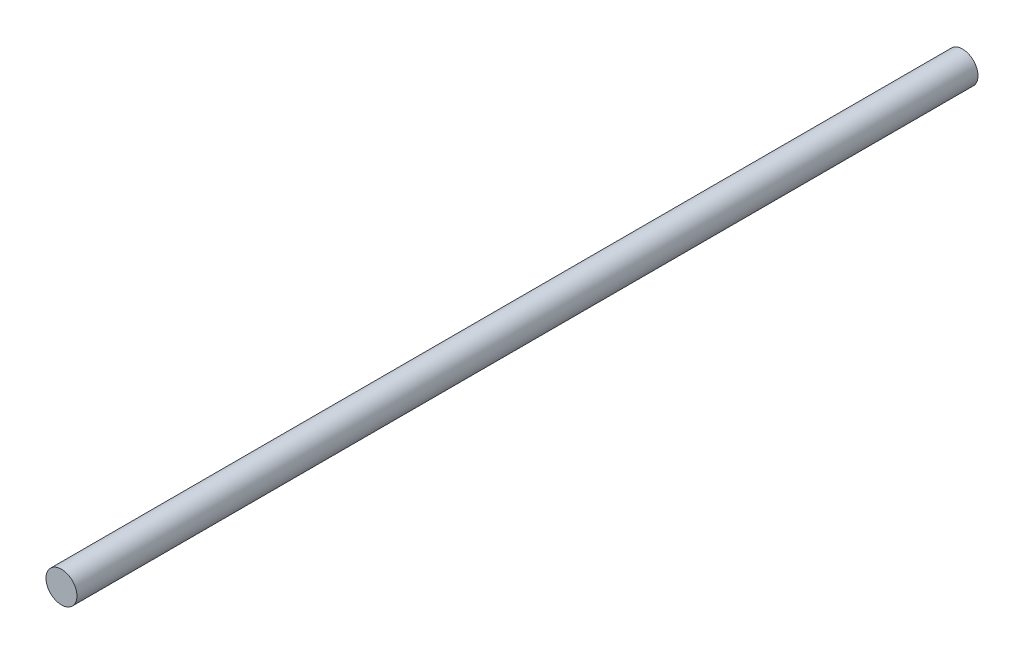
from build123d import *

# Parameters (mm, degrees)
CROQUIS1_R              = 6
SALIENTE_EXTRUIR1_DEPTH = 349.2


with BuildPart() as part:
    # Croquis1 → Saliente-Extruir1 (new body)
    with BuildSketch(Plane.XY):
        Circle(CROQUIS1_R)
    extrude(amount=SALIENTE_EXTRUIR1_DEPTH)


solid = part.part
